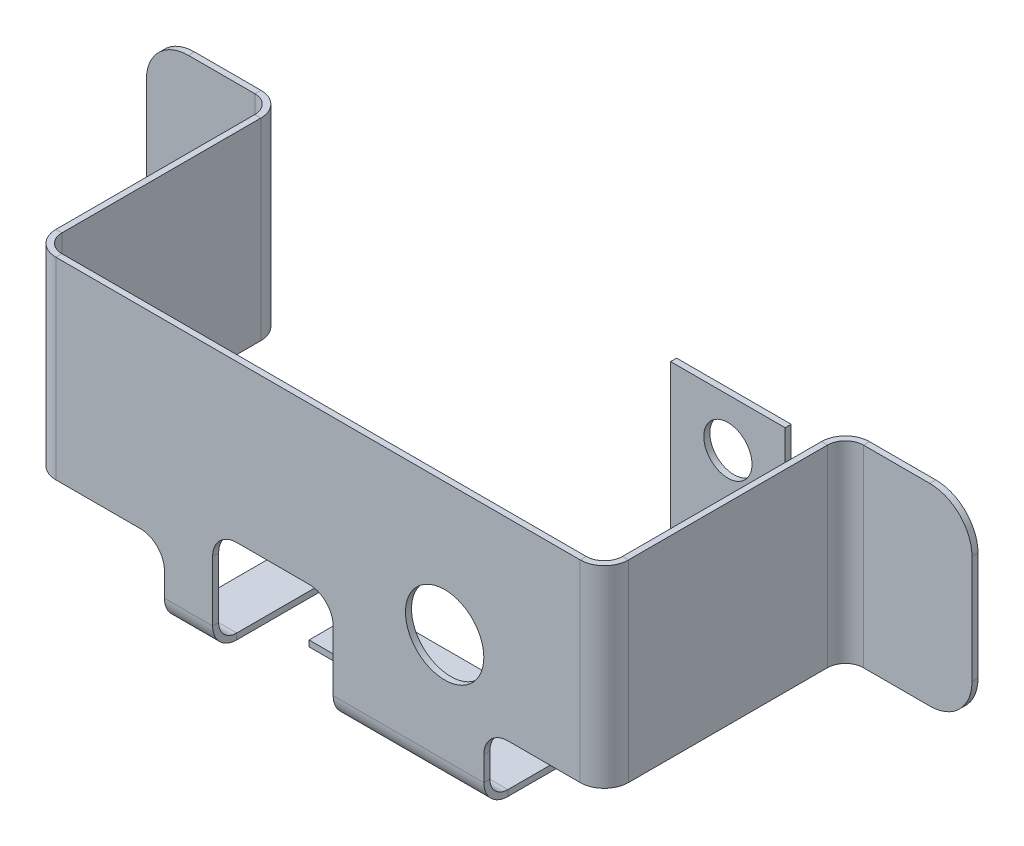
from build123d import *

# Parameters (mm, degrees)
BASE_FLANGE1_DEPTH           = 1
SKETCH6_R                    = 6.5
CUT_EXTRUDE1_DEPTH           = 10
EDGE_FLANGE1_STRIP_W         = 10
EDGE_FLANGE1_STRIP_H         = 1
EDGE_FLANGE1_STRIP_CUT_DEPTH = 32
EDGE_FLANGE1_DEPTH           = 32
EDGE_FLANGE2_STRIP_W         = 10
EDGE_FLANGE2_STRIP_H         = 1
EDGE_FLANGE2_STRIP_CUT_DEPTH = 32
EDGE_FLANGE2_DEPTH           = 32
EDGE_FLANGE2_FLAT_DEPTH      = 1
EDGE_FLANGE3_STRIP_W         = 10
EDGE_FLANGE3_STRIP_H         = 1
EDGE_FLANGE3_STRIP_CUT_DEPTH = 8
EDGE_FLANGE3_DEPTH           = 8
EDGE_FLANGE4_STRIP_W         = 10
EDGE_FLANGE4_STRIP_H         = 1
EDGE_FLANGE4_STRIP_CUT_DEPTH = 25
EDGE_FLANGE4_DEPTH           = 25
EDGE_FLANGE4_FLAT_DEPTH      = 1
EDGE_FLANGE5_STRIP_W         = 10
EDGE_FLANGE5_STRIP_H         = 1
EDGE_FLANGE5_STRIP_CUT_DEPTH = 19
EDGE_FLANGE5_DEPTH           = 19
EDGE_FLANGE5_PROFILE_W       = 19
EDGE_FLANGE5_PROFILE_H       = 26
EDGE_FLANGE5_PROFILE_R       = 4
EDGE_FLANGE5_FLAT_DEPTH      = 1


# Sheet-metal steps are written as plain solids
with BuildPart() as part:
    # Sketch1 → Base-Flange1 (new body)
    with BuildSketch(Plane.XY):
        with BuildLine():
            Line((-47.5, 0), (47.5, 0))
            Line((47.5, 0), (47.5, -32))
            Line((47.5, -32), (31.5, -32))
            ThreePointArc((31.5, -32), (28.671572875, -33.171572875), (27.5, -36))
            Line((27.5, -36), (27.5, -44))
            Line((27.5, -44), (2.5, -44))
            Line((2.5, -44), (2.5, -30))
            ThreePointArc((2.5, -30), (1.328427125, -27.171572875), (-1.5, -26))
            Line((-1.5, -26), (-13.5, -26))
            ThreePointArc((-13.5, -26), (-16.328427125, -27.171572875), (-17.5, -30))
            Line((-17.5, -30), (-17.5, -44))
            Line((-17.5, -44), (-25.5, -44))
            Line((-25.5, -44), (-25.5, -36))
            ThreePointArc((-25.5, -36), (-26.671572875, -33.171572875), (-29.5, -32))
            Line((-29.5, -32), (-47.5, -32))
            Line((-47.5, -32), (-47.5, 0))
        make_face()
    extrude(amount=-BASE_FLANGE1_DEPTH)

    # Sketch6 → Cut-Extrude1 (cut)
    with BuildSketch(Plane.XY):
        with Locations((21, -22)):
            Circle(SKETCH6_R)
    extrude(amount=-CUT_EXTRUDE1_DEPTH, mode=Mode.SUBTRACT)

    # Edge-Flange1 strip (across the edge) → Edge-Flange1 strip cut (cut)
    with BuildSketch(Plane(origin=(47.5, 0, -1), x_dir=(-1, 0, 0), z_dir=(0, -1, 0))):
        with Locations((-1, -0.5)):
            Rectangle(EDGE_FLANGE1_STRIP_W, EDGE_FLANGE1_STRIP_H)
    edge_flange1_strip_cut = extrude(amount=EDGE_FLANGE1_STRIP_CUT_DEPTH, mode=Mode.SUBTRACT)

    # Edge-Flange1 section (across the edge) → Edge-Flange1 (add)
    with BuildSketch(Plane(origin=(47.5, 0, -1), x_dir=(-1, 0, 0), z_dir=(0, -1, 0))):
        with BuildLine():
            Line((0, 3), (0, 40))
            Line((0, 40), (1, 40))
            Line((1, 40), (1, 3))
            ThreePointArc((1, 3), (1.878679656, 0.878679656), (4, 0))
            Line((4, 0), (4, -1))
            ThreePointArc((4, -1), (1.171572875, 0.171572875), (0, 3))
        make_face()
    edge_flange1 = extrude(amount=EDGE_FLANGE1_DEPTH)

    # Edge-Flange2 strip (across the edge) → Edge-Flange2 strip cut (cut)
    with BuildSketch(Plane(origin=(47.5, -32, -41), x_dir=(0, 0, 1), z_dir=(0, 1, 0))):
        with Locations((-1, -0.5)):
            Rectangle(EDGE_FLANGE2_STRIP_W, EDGE_FLANGE2_STRIP_H)
    edge_flange2_strip_cut = extrude(amount=EDGE_FLANGE2_STRIP_CUT_DEPTH, mode=Mode.SUBTRACT)

    # Edge-Flange2 bend section (across the edge) → Edge-Flange2 (add)
    with BuildSketch(Plane(origin=(47.5, -32, -41), x_dir=(0, 0, 1), z_dir=(0, 1, 0))):
        with BuildLine():
            Line((0, 3), (1, 3))
            ThreePointArc((1, 3), (1.878679656, 0.878679656), (4, 0))
            Line((4, 0), (4, -1))
            ThreePointArc((4, -1), (1.171572875, 0.171572875), (0, 3))
        make_face()
    edge_flange2 = extrude(amount=EDGE_FLANGE2_DEPTH)

    # Edge-Flange2 profile (on flange) → Edge-Flange2 flat (add)
    with BuildSketch(Plane(origin=(47.5, 0, -41), x_dir=(0, 1, 0), z_dir=(0, 0, -1))):
        with BuildLine():
            Line((-32, 3), (0, 3))
            Line((0, 3), (0, 14))
            ThreePointArc((0, 14), (-2.050252532, 18.949747468), (-7, 21))
            Line((-7, 21), (-25, 21))
            ThreePointArc((-25, 21), (-29.949747468, 18.949747468), (-32, 14))
            Line((-32, 14), (-32, 3))
        make_face()
    edge_flange2_flat = extrude(amount=-EDGE_FLANGE2_FLAT_DEPTH)

    # Mirror1: Edge-Flange1 strip cut, Edge-Flange1, Edge-Flange2 strip cut, Edge-Flange2, Edge-Flange2 flat across plane
    add(edge_flange1_strip_cut.mirror(Plane(origin=(0, 0, 0), x_dir=(0, 0, 1), z_dir=(1, 0, 0))), mode=Mode.SUBTRACT)
    add(edge_flange1.mirror(Plane(origin=(0, 0, 0), x_dir=(0, 0, 1), z_dir=(1, 0, 0))))
    add(edge_flange2_strip_cut.mirror(Plane(origin=(0, 0, 0), x_dir=(0, 0, 1), z_dir=(1, 0, 0))), mode=Mode.SUBTRACT)
    add(edge_flange2.mirror(Plane(origin=(0, 0, 0), x_dir=(0, 0, 1), z_dir=(1, 0, 0))))
    add(edge_flange2_flat.mirror(Plane(origin=(0, 0, 0), x_dir=(0, 0, 1), z_dir=(1, 0, 0))))

    # Edge-Flange3 strip (across the edge) → Edge-Flange3 strip cut (cut)
    with BuildSketch(Plane(origin=(-17.5, -44, -1), x_dir=(0, 1, 0), z_dir=(-1, 0, 0))):
        with Locations((-1, -0.5)):
            Rectangle(EDGE_FLANGE3_STRIP_W, EDGE_FLANGE3_STRIP_H)
    extrude(amount=EDGE_FLANGE3_STRIP_CUT_DEPTH, mode=Mode.SUBTRACT)

    # Edge-Flange3 section (across the edge) → Edge-Flange3 (add)
    with BuildSketch(Plane(origin=(-17.5, -44, -1), x_dir=(0, 1, 0), z_dir=(-1, 0, 0))):
        with BuildLine():
            Line((0, 3), (0, 18))
            Line((0, 18), (1, 18))
            Line((1, 18), (1, 3))
            ThreePointArc((1, 3), (1.878679656, 0.878679656), (4, 0))
            Line((4, 0), (4, -1))
            ThreePointArc((4, -1), (1.171572875, 0.171572875), (0, 3))
        make_face()
    extrude(amount=EDGE_FLANGE3_DEPTH)

    # Edge-Flange4 strip (across the edge) → Edge-Flange4 strip cut (cut)
    with BuildSketch(Plane(origin=(27.5, -44, -1), x_dir=(0, 1, 0), z_dir=(-1, 0, 0))):
        with Locations((-1, -0.5)):
            Rectangle(EDGE_FLANGE4_STRIP_W, EDGE_FLANGE4_STRIP_H)
    extrude(amount=EDGE_FLANGE4_STRIP_CUT_DEPTH, mode=Mode.SUBTRACT)

    # Edge-Flange4 bend section (across the edge) → Edge-Flange4 (add)
    with BuildSketch(Plane(origin=(27.5, -44, -1), x_dir=(0, 1, 0), z_dir=(-1, 0, 0))):
        with BuildLine():
            Line((0, 3), (1, 3))
            ThreePointArc((1, 3), (1.878679656, 0.878679656), (4, 0))
            Line((4, 0), (4, -1))
            ThreePointArc((4, -1), (1.171572875, 0.171572875), (0, 3))
        make_face()
    extrude(amount=EDGE_FLANGE4_DEPTH)

    # Edge-Flange4 profile (on flange) → Edge-Flange4 flat (add)
    with BuildSketch(Plane(origin=(0, -44, -1), x_dir=(-1, 0, 0), z_dir=(0, -1, 0))):
        Polygon((-27.5, 3), (-2.5, 3), (-2.5, 8), (10.5, 8), (10.5, 14.535898385), (4.5, 18), (-2.5, 18), (-8.5, 18), (-8.5, 50), (-27.5, 50), align=None)
    extrude(amount=-EDGE_FLANGE4_FLAT_DEPTH)

    # Edge-Flange5 strip (across the edge) → Edge-Flange5 strip cut (cut)
    with BuildSketch(Plane(origin=(27.5, -43, -51), x_dir=(0, 0, 1), z_dir=(-1, 0, 0))):
        with Locations((-1, -0.5)):
            Rectangle(EDGE_FLANGE5_STRIP_W, EDGE_FLANGE5_STRIP_H)
    extrude(amount=EDGE_FLANGE5_STRIP_CUT_DEPTH, mode=Mode.SUBTRACT)

    # Edge-Flange5 bend section (across the edge) → Edge-Flange5 (add)
    with BuildSketch(Plane(origin=(27.5, -43, -51), x_dir=(0, 0, 1), z_dir=(-1, 0, 0))):
        with BuildLine():
            Line((0, 3), (1, 3))
            ThreePointArc((1, 3), (1.878679656, 0.878679656), (4, 0))
            Line((4, 0), (4, -1))
            ThreePointArc((4, -1), (1.171572875, 0.171572875), (0, 3))
        make_face()
    extrude(amount=EDGE_FLANGE5_DEPTH)

    # Edge-Flange5 profile (on flange) → Edge-Flange5 flat (add)
    with BuildSketch(Plane(origin=(0, -43, -51), x_dir=(-1, 0, 0), z_dir=(0, 0, -1))):
        with Locations((-18, 16)):
            Rectangle(EDGE_FLANGE5_PROFILE_W, EDGE_FLANGE5_PROFILE_H)
        with Locations((-18, 21)):
            Circle(EDGE_FLANGE5_PROFILE_R, mode=Mode.SUBTRACT)
    extrude(amount=-EDGE_FLANGE5_FLAT_DEPTH)


solid = part.part
